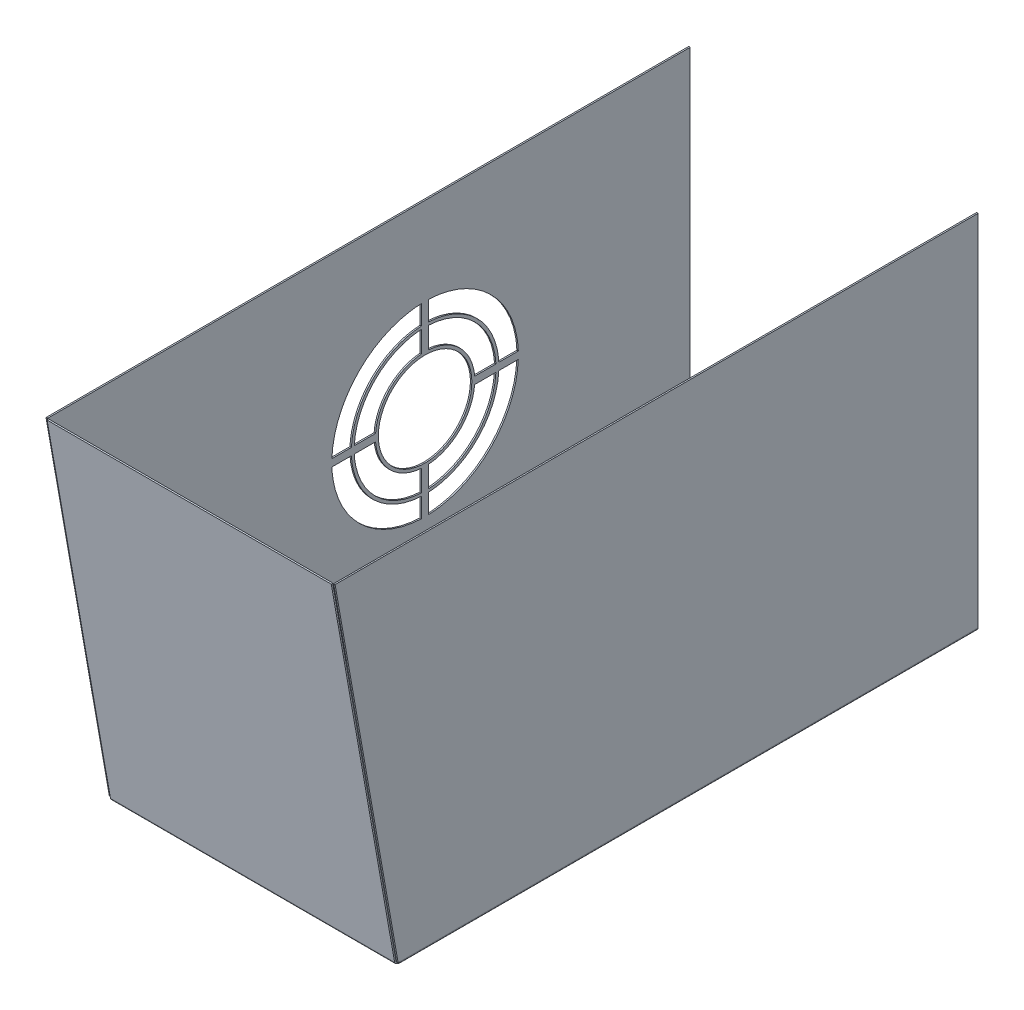
from build123d import *

# Parameters (mm, degrees)
ODGI_CIE_BAZOWE1_DEPTH    = 400
ODGI_CIE_KRAW_DZI1_DEPTH  = 196.5268
WYPUST4_DEPTH             = 1
WYPUST5_DEPTH             = 1
OTW_R_START               = -100
OTW_R_WENTYLACYJNY1_DEPTH = 1


# Read off the part's stored shape, not the designer's step: Otwór wentylacyjny1
# Sheet-metal steps are written as plain solids
with BuildPart() as part:
    # Szkic1 → Odgięcie bazowe1 (new body)
    with BuildSketch(Plane.XY):
        with BuildLine():
            Line((-100, 125), (-100, -123.2634))
            ThreePointArc((-100, -123.2634), (-99.491361636, -124.491361636), (-98.2634, -125))
            Line((-98.2634, -125), (98.2634, -125))
            ThreePointArc((98.2634, -125), (99.491361636, -124.491361636), (100, -123.2634))
            Line((100, -123.2634), (100, 125))
            Line((100, 125), (99, 125))
            Line((99, 125), (99, -123.2634))
            ThreePointArc((99, -123.2634), (98.784254855, -123.784254855), (98.2634, -124))
            Line((98.2634, -124), (-98.2634, -124))
            ThreePointArc((-98.2634, -124), (-98.784254855, -123.784254855), (-99, -123.2634))
            Line((-99, -123.2634), (-99, 125))
            Line((-99, 125), (-100, 125))
        make_face()
    extrude(amount=ODGI_CIE_BAZOWE1_DEPTH)

    # Odgięcie krawędzi1 section (across the edge) → Odgięcie krawędzi1 (add)
    with BuildSketch(Plane(origin=(-98.2634, -124, 400.618080788), x_dir=(0, 0.173648177666934, -0.9848077530122075), z_dir=(1, 0, 0))):
        with BuildLine():
            Line((-1, 0.618080788), (-1, 252.84122636))
            Line((-1, 252.84122636), (0, 252.84122636))
            Line((0, 252.84122636), (0, 0.618080788))
            ThreePointArc((0, 0.618080788), (0.172331663, 0.144603435), (0.608690752, -0.107328603))
            Line((0.608690752, -0.107328603), (0.435042575, -1.092136356))
            ThreePointArc((0.435042575, -1.092136356), (-0.59371278, -0.498184175), (-1, 0.618080788))
        make_face()
    extrude(amount=ODGI_CIE_KRAW_DZI1_DEPTH)

    # Szkic26 → Wypust4 (add)
    with BuildSketch(Plane(origin=(100, 0, 0), x_dir=(0, 0, -1), z_dir=(1, 0, 0))):
        Polygon((-400, 125), (-400, -123.2634), (-401.018909627, -123.2634), (-444.612458493, 125), align=None)
    extrude(amount=-WYPUST4_DEPTH)

    # Szkic29 → Wypust5 (add)
    with BuildSketch(Plane.ZY.offset(100)):
        Polygon((400, -123.2634), (400, 125), (444.534061767, 125), (400.770256223, -123.2634), align=None)
    extrude(amount=-WYPUST5_DEPTH)

    # Otwór wentylacyjny1 outline → Otwór wentylacyjny1 (cut)
    with BuildSketch(Plane.YZ.offset(OTW_R_START)):
        with BuildLine():
            add(Edge.make_bspline(
                [(-2.499997455, 118.904320028), (-3.7766207, 118.953616399), (-7.159019941, 119.184778762), (-12.605694132, 119.994673176), (-18.75745911, 121.53328701), (-24.727125649, 123.671634985), (-30.46051751, 126.380834605), (-35.898307622, 129.642718959), (-40.992995203, 133.418391452), (-45.689935023, 137.678456563), (-49.950130967, 142.375506005), (-53.725722466, 147.470037663), (-56.987715492, 152.907959959), (-59.696864566, 158.641183892), (-61.835295322, 164.611004969), (-63.373892191, 170.762595457), (-64.183834339, 176.209437972), (-64.415010516, 179.591836883), (-64.464313702, 180.86863562)],
                knots=[0.506169004, 0.506169004, 0.506169004, 0.506169004, 0.515624378, 0.531249997, 0.546874378, 0.562499997, 0.578124378, 0.593749997, 0.609374378, 0.624999997, 0.640624347, 0.656249997, 0.671874316, 0.687499997, 0.703124316, 0.718749997, 0.734374316, 0.743830988, 0.743830988, 0.743830988, 0.743830988], degree=3))
            Line((-2.499997455, 118.904320028), (-2.499997113, 132.397768213))
            add(Edge.make_bspline(
                [(-2.499997113, 132.397768213), (-3.33527748, 132.438587622), (-5.835644145, 132.622435698), (-9.971531145, 133.237419114), (-14.837836055, 134.454523467), (-19.560045792, 136.146025572), (-24.095400747, 138.28911259), (-28.396878822, 140.869370406), (-32.426992802, 143.856082347), (-36.142438465, 147.225941248), (-39.512437823, 150.941499395), (-42.499065845, 154.971459892), (-45.079437735, 159.273076547), (-47.222473918, 163.808263795), (-48.914058883, 168.530628011), (-50.131146248, 173.396758447), (-50.746176522, 177.53281395), (-50.930037491, 180.033180056), (-50.970865492, 180.86863578)],
                knots=[0.507799796, 0.507799796, 0.507799796, 0.507799796, 0.515624135, 0.531249996, 0.546874135, 0.562499996, 0.578124135, 0.593749996, 0.609374135, 0.624999996, 0.640624174, 0.656249996, 0.671874213, 0.687499996, 0.703124213, 0.718749996, 0.734374213, 0.742200194, 0.742200194, 0.742200194, 0.742200194], degree=3))
            Line((-50.970865492, 180.86863578), (-64.464313702, 180.86863562))
        make_face()
        with BuildLine():
            add(Edge.make_bspline(
                [(-64.464313817, 185.868631258), (-64.41501777, 187.145246147), (-64.183856064, 190.527645403), (-63.373963925, 195.974311579), (-61.835349281, 202.126084865), (-59.697005249, 208.095744045), (-56.987803223, 213.829143907), (-53.725924139, 219.266927533), (-49.950247846, 224.361622629), (-45.690185895, 229.058559725), (-40.993132457, 233.318763789), (-35.898599427, 237.094353662), (-30.46067399, 240.356349563), (-24.727449867, 243.065497956), (-18.757629083, 245.203930724), (-12.605992694, 246.742531463), (-7.159151604, 247.552491768), (-3.776751335, 247.783657899), (-2.499998, 247.832955682)],
                knots=[0.756169004, 0.756169004, 0.756169004, 0.756169004, 0.765624316, 0.781249997, 0.796874316, 0.812499997, 0.828124316, 0.843749997, 0.859374316, 0.874999997, 0.890624316, 0.906249997, 0.921874316, 0.937499997, 0.953124316, 0.968749997, 0.984374658, 0.993830993, 0.993830993, 0.993830993, 0.993830993], degree=3))
            Line((-64.464313817, 185.868631258), (-50.97086562, 185.868630997))
            add(Edge.make_bspline(
                [(-50.97086562, 185.868630997), (-50.930045802, 186.703919715), (-50.746197112, 189.204286353), (-50.131211465, 193.340181377), (-48.91410792, 198.206477978), (-47.222601873, 202.928695075), (-45.079517261, 207.464042029), (-42.499254174, 211.765526589), (-39.512546034, 215.795633056), (-36.142683971, 219.511081438), (-32.427129823, 222.881072695), (-28.397170689, 225.867702271), (-24.095557211, 228.448071555), (-19.560370019, 230.591107414), (-14.83800601, 232.282694115), (-9.971833858, 233.499785071), (-5.835779548, 234.114831033), (-3.335412305, 234.298684886), (-2.499997828, 234.339508502)],
                knots=[0.757799796, 0.757799796, 0.757799796, 0.757799796, 0.765624213, 0.781249996, 0.796874213, 0.812499996, 0.828124213, 0.843749996, 0.859374213, 0.874999996, 0.890624213, 0.906249996, 0.921874213, 0.937499996, 0.953124213, 0.968749996, 0.984374607, 0.9922002, 0.9922002, 0.9922002, 0.9922002], degree=3))
            Line((-2.499997828, 234.339508502), (-2.499998, 247.832955682))
        make_face()
        with BuildLine():
            add(Edge.make_bspline(
                [(64.464313811, 180.868636385), (64.41501744, 179.592013139), (64.183855078, 176.209613898), (63.373960663, 170.762939707), (61.83534683, 164.611174729), (59.696998852, 158.641508192), (56.987799241, 152.908116321), (53.725914853, 147.470326248), (49.950242487, 142.375638519), (45.690174077, 137.678696133), (40.993125926, 133.418498538), (35.898585534, 129.642904701), (30.460666526, 126.380914245), (24.727434481, 123.67176291), (18.757620793, 121.533336056), (12.606021988, 119.99473839), (7.15918749, 119.184798512), (3.776788563, 118.953622993), (2.499998183, 118.904320132)],
                knots=[0.256169004, 0.256169004, 0.256169004, 0.256169004, 0.265624378, 0.281249997, 0.296874378, 0.312499997, 0.328124378, 0.343749997, 0.359374378, 0.374999997, 0.390624378, 0.406249997, 0.421874378, 0.437499997, 0.453124378, 0.468749997, 0.484374378, 0.493830989, 0.493830989, 0.493830989, 0.493830989], degree=3))
            Line((64.464313811, 180.868636385), (50.970865636, 180.868636726))
            add(Edge.make_bspline(
                [(50.970865636, 180.868636726), (50.930046225, 180.033356359), (50.746198133, 177.532989691), (50.131214728, 173.397102695), (48.914110371, 168.530797785), (47.22260827, 163.808588045), (45.079521242, 159.273233101), (42.49926346, 154.971754986), (39.512551393, 150.941641154), (36.14269579, 147.226198057), (32.427136352, 143.856200351), (28.39718459, 140.869574666), (24.095564647, 138.289200208), (19.560385511, 136.146166285), (14.838013905, 134.454577418), (9.971891787, 133.23749085), (5.835828258, 132.622458348), (3.335462179, 132.438596765), (2.499998104, 132.397768354)],
                knots=[0.257799796, 0.257799796, 0.257799796, 0.257799796, 0.265624135, 0.281249996, 0.296874135, 0.312499996, 0.328124135, 0.343749996, 0.359374135, 0.374999996, 0.390624135, 0.406249996, 0.421874135, 0.437499996, 0.453124135, 0.468749996, 0.484374135, 0.492200194, 0.492200194, 0.492200194, 0.492200194], degree=3))
            Line((2.499998104, 132.397768354), (2.499998183, 118.904320132))
        make_face()
        with BuildLine():
            add(Edge.make_bspline(
                [(2.499997637, 247.832939516), (3.776657924, 247.783638068), (7.159055824, 247.552466319), (12.605723421, 246.742592328), (18.75745082, 245.203981567), (24.727110261, 243.065639504), (30.460510053, 240.356436951), (35.898293695, 237.094558007), (40.992988798, 233.318881682), (45.689925852, 229.058819717), (49.950130075, 224.36176637), (53.725721859, 219.267229609), (56.987719491, 213.829305098), (59.696869001, 208.096072022), (61.83529792, 202.126254702), (63.373895412, 195.974655808), (64.183835331, 190.527821331), (64.415010849, 187.145422403), (64.464313709, 185.868632022)],
                knots=[0.006169008, 0.006169008, 0.006169008, 0.006169008, 0.015624658, 0.031249997, 0.046874316, 0.062499997, 0.078124316, 0.093749997, 0.109374316, 0.124999997, 0.140624316, 0.156249997, 0.171874347, 0.187499997, 0.203124378, 0.218749997, 0.234374378, 0.243830989, 0.243830989, 0.243830989, 0.243830989], degree=3))
            Line((2.499997637, 247.832939516), (2.499997383, 234.339489706))
            add(Edge.make_bspline(
                [(2.499997383, 234.339489706), (3.33532311, 234.298665412), (5.83568855, 234.114808991), (9.971576824, 233.49984317), (14.837835849, 232.282742647), (19.560045849, 230.591242528), (24.095400725, 228.44815497), (28.396878855, 225.867897328), (32.426992693, 222.881185229), (36.14243575, 219.511329613), (39.512433612, 215.795770262), (42.49906122, 211.765814781), (45.079437365, 207.464195723), (47.222470768, 202.929011593), (48.914055736, 198.206643152), (50.131144122, 193.3405216), (50.746175462, 189.204462093), (50.930037029, 186.704096012), (50.970865447, 185.868631942)],
                knots=[0.007799802, 0.007799802, 0.007799802, 0.007799802, 0.015624567, 0.031249996, 0.046874135, 0.062499996, 0.078124135, 0.093749996, 0.109374135, 0.124999996, 0.140624135, 0.156249996, 0.171874174, 0.187499996, 0.203124174, 0.218749996, 0.234374135, 0.242200194, 0.242200194, 0.242200194, 0.242200194], degree=3))
            Line((50.970865447, 185.868631942), (64.464313709, 185.868632022))
        make_face()
        with BuildLine():
            Line((2.5, 232.336992995), (2.499983341, 217.610009413))
            add(Edge.make_bspline(
                [(2.499983341, 217.610009413), (3.909225902, 217.507065437), (7.543152161, 217.015350628), (13.223223674, 215.292319772), (19.197145308, 212.099192134), (24.433331413, 207.801965253), (28.730558295, 202.565779147), (31.923685933, 196.591857514), (33.6467168, 190.911785966), (34.138431607, 187.277859669), (34.241375581, 185.868617072)],
                knots=[0.011599443, 0.011599443, 0.011599443, 0.011599443, 0.03125, 0.0625, 0.09375, 0.125, 0.15625, 0.1875, 0.21875, 0.238400557, 0.238400557, 0.238400557, 0.238400557], degree=3))
            Line((34.241375581, 185.868617072), (48.968369278, 185.868633839))
            add(Edge.make_bspline(
                [(2.5, 232.336992995), (3.269847049, 232.297825091), (5.639363178, 232.121189552), (9.580773409, 231.535141676), (14.256319646, 230.365740645), (18.793457369, 228.740534222), (23.15106966, 226.681435804), (27.283964854, 224.202303837), (31.156136964, 221.332643012), (34.725967691, 218.094855643), (37.963895383, 214.524912381), (40.833470371, 210.652897474), (43.312714683, 206.519862776), (45.371761149, 202.162427145), (46.997054281, 197.625131479), (48.166441571, 192.949722226), (48.752555646, 189.008136428), (48.929196765, 186.638619459), (48.968369278, 185.868633839)],
                knots=[0.008118235, 0.008118235, 0.008118235, 0.008118235, 0.01562455, 0.031249996, 0.046874099, 0.062499996, 0.078124099, 0.093749996, 0.109374099, 0.124999996, 0.14062414, 0.156249996, 0.17187414, 0.187499996, 0.203124099, 0.218749996, 0.234374099, 0.241881762, 0.241881762, 0.241881762, 0.241881762], degree=3))
        make_face()
        with BuildLine():
            Line((48.968369375, 180.868633839), (34.241375616, 180.868651082))
            add(Edge.make_bspline(
                [(34.241375616, 180.868651082), (34.13843165, 179.459408324), (33.646716846, 175.825481865), (31.923685933, 170.145410165), (28.730558295, 164.171488531), (24.433331413, 158.935302426), (19.197145308, 154.638075545), (13.223223674, 151.444947906), (7.543152127, 149.72191704), (3.90922583, 149.230202232), (2.499983232, 149.127258258)],
                knots=[0.26159944, 0.26159944, 0.26159944, 0.26159944, 0.28125, 0.3125, 0.34375, 0.375, 0.40625, 0.4375, 0.46875, 0.488400557, 0.488400557, 0.488400557, 0.488400557], degree=3))
            Line((2.499983232, 149.127258258), (2.5, 134.400264558))
            add(Edge.make_bspline(
                [(48.968369375, 180.868633839), (48.929206229, 180.098832239), (48.752578426, 177.729314986), (48.166513273, 173.787906111), (46.997108359, 169.112313988), (45.371899968, 164.575176523), (43.312802069, 160.217564173), (40.833669993, 156.084668961), (37.964009086, 152.212496981), (34.72622498, 148.642668867), (31.156280525, 145.404742657), (27.284270616, 142.535168133), (23.151233575, 140.055919381), (18.793797033, 137.996874586), (14.256497702, 136.371579431), (9.581088369, 135.202192303), (5.639502589, 134.616078192), (3.26998562, 134.439437071), (2.5, 134.400264558)],
                knots=[0.25811823, 0.25811823, 0.25811823, 0.25811823, 0.265624099, 0.281249996, 0.296874099, 0.312499996, 0.328124099, 0.343749996, 0.359374099, 0.374999996, 0.390624099, 0.406249996, 0.421874099, 0.437499996, 0.453124099, 0.468749996, 0.484374099, 0.491881762, 0.491881762, 0.491881762, 0.491881762], degree=3))
        make_face()
        with BuildLine():
            Line((-48.968369375, 185.868633833), (-34.241375616, 185.868616597))
            add(Edge.make_bspline(
                [(-34.241375616, 185.868616597), (-34.13843165, 187.277859354), (-33.646716846, 190.911785813), (-31.923685933, 196.591857514), (-28.730558295, 202.565779147), (-24.433331413, 207.801965253), (-19.197145308, 212.099192134), (-13.223223674, 215.292319772), (-7.543151939, 217.015350696), (-3.909225443, 217.507065499), (-2.499982649, 217.610009463)],
                knots=[0.76159944, 0.76159944, 0.76159944, 0.76159944, 0.78125, 0.8125, 0.84375, 0.875, 0.90625, 0.9375, 0.96875, 0.98840056, 0.98840056, 0.98840056, 0.98840056], degree=3))
            Line((-2.499982649, 217.610009463), (-2.5, 232.337013341))
            add(Edge.make_bspline(
                [(-48.968369375, 185.868633833), (-48.929206228, 186.638435435), (-48.752578427, 189.00795269), (-48.166513273, 192.949361568), (-46.997108359, 197.624953691), (-45.371899968, 202.162091155), (-43.312802069, 206.519703506), (-40.833669993, 210.652598718), (-37.964009087, 214.524770698), (-34.72622498, 218.094598809), (-31.156280526, 221.332525029), (-27.284270612, 224.202099516), (-23.15123359, 226.68134841), (-18.793796978, 228.740392676), (-14.256497909, 230.365689802), (-9.581042683, 231.535080811), (-5.63945826, 232.121212207), (-3.269940166, 232.297845587), (-2.5, 232.337013341)],
                knots=[0.75811823, 0.75811823, 0.75811823, 0.75811823, 0.765624099, 0.781249996, 0.796874099, 0.812499996, 0.828124099, 0.843749996, 0.859374099, 0.874999996, 0.890624099, 0.906249996, 0.921874099, 0.937499996, 0.953124099, 0.968749996, 0.98437455, 0.991881768, 0.991881768, 0.991881768, 0.991881768], degree=3))
        make_face()
        with BuildLine():
            Line((-2.5, 134.400264465), (-2.499982758, 149.127258224))
            add(Edge.make_bspline(
                [(-2.499982758, 149.127258224), (-3.909225515, 149.230202189), (-7.543151974, 149.721916993), (-13.223223674, 151.444947906), (-19.197145308, 154.638075545), (-24.433331413, 158.935302426), (-28.730558295, 164.171488531), (-31.923685933, 170.145410165), (-33.6467168, 175.825481713), (-34.138431607, 179.45940801), (-34.241375581, 180.868650607)],
                knots=[0.51159944, 0.51159944, 0.51159944, 0.51159944, 0.53125, 0.5625, 0.59375, 0.625, 0.65625, 0.6875, 0.71875, 0.738400557, 0.738400557, 0.738400557, 0.738400557], degree=3))
            Line((-34.241375581, 180.868650607), (-48.968369281, 180.868633839))
            add(Edge.make_bspline(
                [(-2.5, 134.400264465), (-3.2698016, 134.439427611), (-5.639318853, 134.616055412), (-9.580727728, 135.202120567), (-14.256319852, 136.37152548), (-18.793457316, 137.996733871), (-23.151069667, 140.05583177), (-27.283964879, 142.534963846), (-31.156136858, 145.404624753), (-34.725964972, 148.642408859), (-37.963891182, 152.212353315), (-40.833465707, 156.084363224), (-43.312714459, 160.217400264), (-45.371759253, 164.574836806), (-46.997054409, 169.112136137), (-48.166441537, 173.78754547), (-48.752555647, 177.72913125), (-48.929196768, 180.098648219), (-48.968369281, 180.868633839)],
                knots=[0.50811823, 0.50811823, 0.50811823, 0.50811823, 0.515624099, 0.531249996, 0.546874099, 0.562499996, 0.578124099, 0.593749996, 0.609374099, 0.624999996, 0.640624099, 0.656249996, 0.671874099, 0.687499996, 0.703124099, 0.718749996, 0.734374099, 0.741881762, 0.741881762, 0.741881762, 0.741881762], degree=3))
        make_face()
        with BuildLine():
            add(Edge.make_bspline(
                [(0, 215.701267686), (2.116148382, 215.701267686), (6.348445147, 215.284422839), (12.452923107, 213.432649694), (18.078842215, 210.425533281), (23.010001556, 206.378635395), (27.056899441, 201.447476054), (30.064015855, 195.821556946), (31.915788999, 189.717078986), (32.541056271, 183.368633839), (31.915788999, 177.020188693), (30.064015855, 170.915710733), (27.056899441, 165.289791624), (23.010001556, 160.358632283), (18.078842215, 156.311734398), (12.452923107, 153.304617984), (6.348445147, 151.45284484), (0, 150.827577568), (-6.348445147, 151.45284484), (-12.452923107, 153.304617984), (-18.078842215, 156.311734398), (-23.010001556, 160.358632283), (-27.056899441, 165.289791624), (-30.064015855, 170.915710733), (-31.915788999, 177.020188693), (-32.541056271, 183.368633839), (-31.915788999, 189.717078986), (-30.064015855, 195.821556946), (-27.056899441, 201.447476054), (-23.010001556, 206.378635395), (-18.078842215, 210.425533281), (-12.452923107, 213.432649694), (-6.348445147, 215.284422839), (-2.116148382, 215.701267686), (0, 215.701267686)],
                knots=[0, 0, 0, 0, 0.03125, 0.0625, 0.09375, 0.125, 0.15625, 0.1875, 0.21875, 0.25, 0.28125, 0.3125, 0.34375, 0.375, 0.40625, 0.4375, 0.46875, 0.5, 0.53125, 0.5625, 0.59375, 0.625, 0.65625, 0.6875, 0.71875, 0.75, 0.78125, 0.8125, 0.84375, 0.875, 0.90625, 0.9375, 0.96875, 1, 1, 1, 1], degree=3))
        make_face()
    extrude(amount=OTW_R_WENTYLACYJNY1_DEPTH, mode=Mode.SUBTRACT)


solid = part.part
